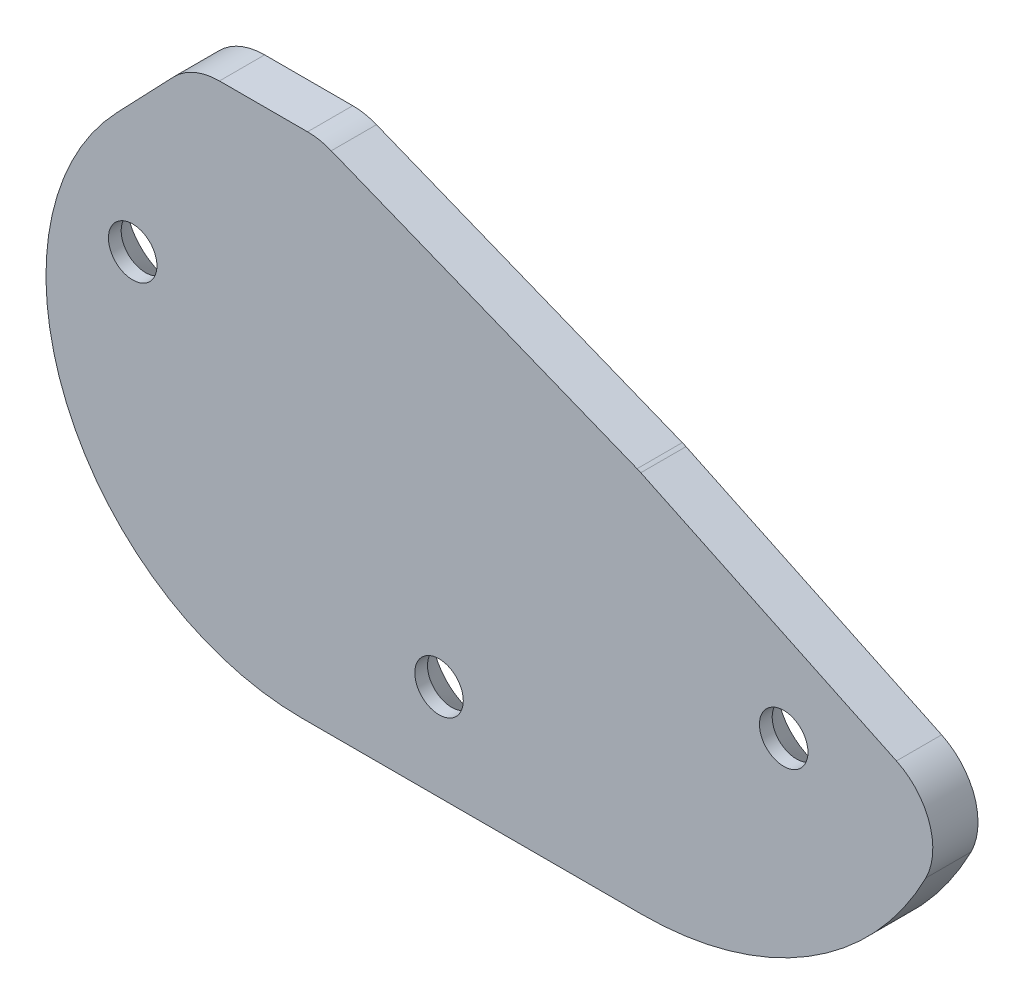
from build123d import *

# Parameters (mm, degrees)
SKETCH1_R          = 2.413
EXTRUDE1_DEPTH     = 4.4958
CUT_EXTRUDE1_DEPTH = 114.681186736
FILLET1_R          = 6.35


with BuildPart() as part:
    # Sketch1 → Extrude1 (new body)
    with BuildSketch(Plane.XY):
        Polygon((26.2420825, 50.8), (0, 23.368), (0, 0), (101.6, 0), (101.6, 23.368), (70.6920825, 38.090460221), (38.9420825, 50.8), align=None)
        with Locations((20.32, 31.75)):
            Circle(SKETCH1_R, mode=Mode.SUBTRACT)
        with Locations((50.8, 9.525)):
            Circle(SKETCH1_R, mode=Mode.SUBTRACT)
        with Locations((85.09, 22.225)):
            Circle(SKETCH1_R, mode=Mode.SUBTRACT)
    extrude(amount=EXTRUDE1_DEPTH)

    # Sketch2 → Cut-Extrude1 (cut, through all)
    with BuildSketch(Plane.XY.offset(4.4958)):
        with BuildLine():
            Line((18.740269579, 42.958025871), (0, 23.368))
            Line((0, 23.368), (0, 0))
            Line((0, 0), (37.094444241, 0))
            ThreePointArc((37.094444241, 0), (13.737070061, 15.420367169), (18.740269579, 42.958025871))
        make_face()
        with BuildLine():
            Line((101.6, 23.368), (101.6, 0))
            Line((101.6, 0), (70.976404914, 0))
            ThreePointArc((70.976404914, 0), (90.236908542, 6.509249219), (101.6, 23.368))
        make_face()
    extrude(amount=-CUT_EXTRUDE1_DEPTH, mode=Mode.SUBTRACT)

    # Fillet1
    # the kernel refuses this fillet: 6.35 mm, written as the material it takes off along each edge
    with BuildSketch(Plane(origin=(26.2420825, 50.8, -6.782726088), x_dir=(-0.6912608610672895, -0.7226053016388058, 0), z_dir=(0, 0, 1))) as fillet1_piece_1:
        with BuildLine():
            CenterArc((FILLET1_R * 0.427258336235, FILLET1_R), FILLET1_R, 223.73, 46.27)
            Line((-FILLET1_R * 0.295346965404, FILLET1_R * 0.308739138933), (0, 0))
            Line((0, 0), (FILLET1_R * 0.427258336235, 0))
        make_face()
    extrude(amount=18.061252175, mode=Mode.SUBTRACT)
    with BuildSketch(Plane(origin=(38.9420825, 50.8, -3.059377728), x_dir=(-1, 0, 0), z_dir=(0, 0, 1))) as fillet1_piece_2:
        with BuildLine():
            CenterArc((FILLET1_R * 0.192716707281, FILLET1_R), FILLET1_R, 248.183751186, 21.816248814)
            Line((-FILLET1_R * 0.178914427547, FILLET1_R * 0.0716195286272), (0, 0))
            Line((0, 0), (FILLET1_R * 0.192716707281, 0))
        make_face()
    extrude(amount=10.614555456, mode=Mode.SUBTRACT)
    with BuildSketch(Plane(origin=(70.6920825, 38.090460221, -0.506345886), x_dir=(-0.9283804713727851, 0.3716311348281322, 0), z_dir=(0, 0, 1))) as fillet1_piece_3:
        with BuildLine():
            CenterArc((FILLET1_R * 0.0318958038441, FILLET1_R), FILLET1_R, 266.346248814, 3.653751186)
            Line((-FILLET1_R * 0.0318309718993, FILLET1_R * 0.00203261673873), (0, 0))
            Line((0, 0), (FILLET1_R * 0.0318958038441, 0))
        make_face()
    extrude(amount=5.508491772, mode=Mode.SUBTRACT)
    with BuildSketch(Plane(origin=(101.6, 23.368, -16.387317761), x_dir=(-0.9028105756982961, 0.43003844526659585, 0), z_dir=(0, 0, 1))) as fillet1_piece_4:
        with BuildLine():
            CenterArc((5.862905037, 6.35), FILLET1_R, 178.312383947, 91.687616053)
            ThreePointArc((-0.484340643, 6.537008757), (-0.411321416, 3.25597162), (0, 0))
            Line((0, 0), (5.862905037, 0))
        make_face()
    extrude(amount=37.270435521, mode=Mode.SUBTRACT)

    # Cut-Extrude2 cone 1 section (through the dimple's axis) → Cut-Extrude2 (revolve, cut)
    with BuildSketch(Plane(origin=(20.32, 31.75, 0), x_dir=(0, 1, 0), z_dir=(1, 0, 0))):
        Polygon((0, 0), (5.2197, 0), (0, 6.004577975), align=None)
    revolve(axis=Axis((20.32, 31.75, 0), (0, 0, 1)), mode=Mode.SUBTRACT)

    # Cut-Extrude2 cone 2 section (through the dimple's axis) → Cut-Extrude2 cone 2 (revolve, cut)
    with BuildSketch(Plane(origin=(50.8, 9.525, 0), x_dir=(0, 1, 0), z_dir=(1, 0, 0))):
        Polygon((0, 0), (5.2197, 0), (0, 6.004577975), align=None)
    revolve(axis=Axis((50.8, 9.525, 0), (0, 0, 1)), mode=Mode.SUBTRACT)

    # Cut-Extrude2 cone 3 section (through the dimple's axis) → Cut-Extrude2 cone 3 (revolve, cut)
    with BuildSketch(Plane(origin=(85.09, 22.225, 0), x_dir=(0, 1, 0), z_dir=(1, 0, 0))):
        Polygon((0, 0), (5.2197, 0), (0, 6.004577975), align=None)
    revolve(axis=Axis((85.09, 22.225, 0), (0, 0, 1)), mode=Mode.SUBTRACT)


solid = part.part
